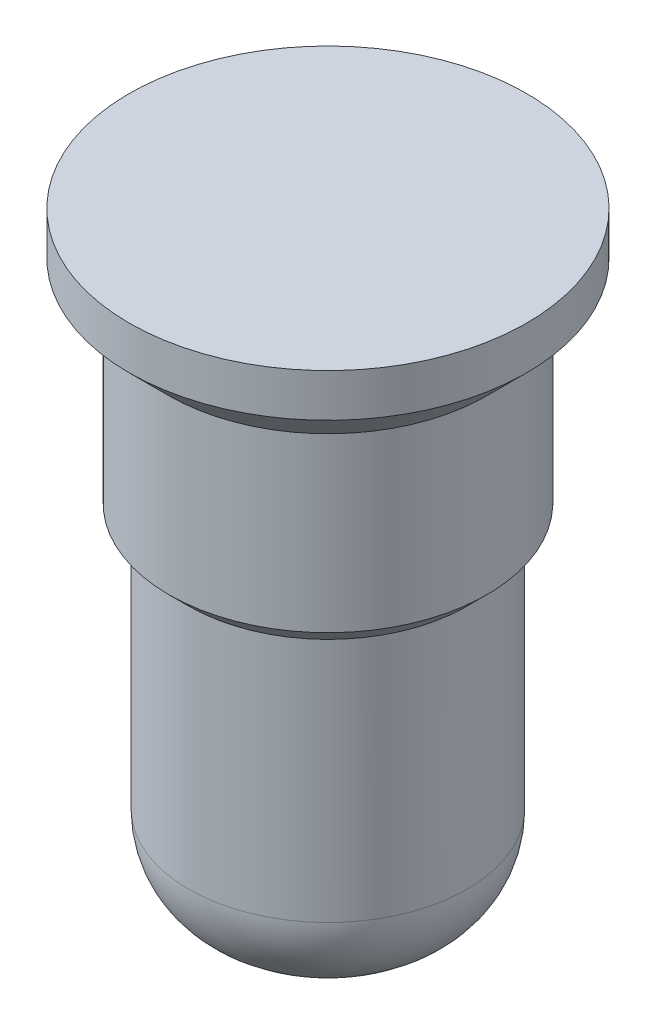
from build123d import *

# Parameters (mm, degrees)
SKETCH1_R           = 1.905
BOSS_EXTRUDE1_DEPTH = 0.79375
SKETCH2_R           = 1.524
BOSS_EXTRUDE2_DEPTH = 2.54
CHAMFER1_SIZE       = 0.381
SKETCH4_R           = 1.3335
BOSS_EXTRUDE3_DEPTH = 2.54
FILLET3_R           = 0.889
CHAMFER2_SIZE       = 0.889


# Some blends are built 0.0001 mm under size
with BuildPart() as part:
    # Sketch1 → Boss-Extrude1 (new body)
    with BuildSketch(Plane(origin=(0, 0, 0), x_dir=(1, 0, 0), z_dir=(0, 1, 0))):
        with Locations(Location((0, 0, 0), (0, 0, 270))):
            Circle(SKETCH1_R)
    extrude(amount=BOSS_EXTRUDE1_DEPTH)

    # Sketch2 → Boss-Extrude2 (add)
    with BuildSketch(Plane.XZ):
        with Locations(Location((0, 0, 0), (0, 0, 270))):
            Circle(SKETCH2_R)
    extrude(amount=BOSS_EXTRUDE2_DEPTH)

    # Chamfer1
    chamfer1_edges = [part.edges().sort_by_distance(p)[0] for p in [
        (0, 0, -1.905),
    ]]
    chamfer(chamfer1_edges, length=CHAMFER1_SIZE - 0.0001)  # a hair under: the kernel refuses the full size

    # Sketch4 → Boss-Extrude3 (add)
    with BuildSketch(Plane.XZ.offset(2.54)):
        with Locations(Location((0, 0, 0), (0, 0, 270))):
            Circle(SKETCH4_R)
    extrude(amount=BOSS_EXTRUDE3_DEPTH)

    # Fillet3
    fillet3_edges = [part.edges().sort_by_distance(p)[0] for p in [
        (0, -5.08, 1.3335),
    ]]
    fillet(fillet3_edges, radius=FILLET3_R)

    # Chamfer2
    # the kernel refuses this chamfer: 0.889 mm, written as the material it takes off along each edge
    with BuildSketch(Plane(origin=(0, -2.54, 0), x_dir=(0, 0, -1), z_dir=(-1, 0, 0))) as chamfer2_piece_1_section:
        Polygon((1.524 - CHAMFER2_SIZE, 0), (1.524, -CHAMFER2_SIZE), (1.524, 0), align=None)
    chamfer2_piece_1 = revolve(axis=Axis((0, -2.54, 0), (0, -1, 0)), mode=Mode.PRIVATE)
    chamfer2_piece_1 = chamfer2_piece_1 - Plane(origin=(0, -1.741914517, 0), x_dir=(0, 0, -1), z_dir=(0, 1, 0)) * Cylinder(1.3335, 7, mode=Mode.PRIVATE)
    add(chamfer2_piece_1, mode=Mode.SUBTRACT)


solid = part.part
